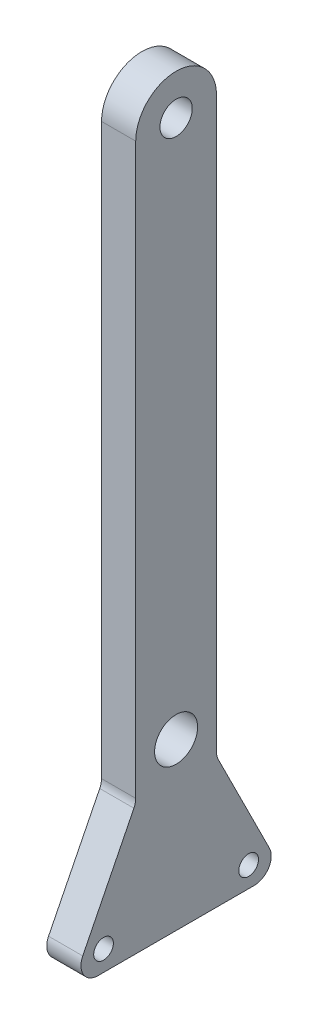
from build123d import *

# Parameters (mm, degrees)
SKETCH1_R           = 1.8288
SKETCH1_R_2         = 4
SKETCH1_R_3         = 3
BOSS_EXTRUDE1_DEPTH = 6.35
FILLET1_R           = 3.175


with BuildPart() as part:
    # Sketch1 → Boss-Extrude1 (new body)
    with BuildSketch(Plane(origin=(0, 0, 0), x_dir=(0, 0, -1), z_dir=(1, 0, 0))):
        with BuildLine():
            Line((-19.639409497, -3.81), (19.639409497, -3.81))
            Line((19.639409497, -3.81), (7.5, 20.468818994))
            Line((7.5, 20.468818994), (7.5, 126.9494))
            ThreePointArc((7.5, 126.9494), (0, 134.4494), (-7.5, 126.9494))
            Line((-7.5, 126.9494), (-7.5, 20.468818994))
            Line((-7.5, 20.468818994), (-19.639409497, -3.81))
        make_face()
        with Locations((-13.4747, 0)):
            Circle(SKETCH1_R, mode=Mode.SUBTRACT)
        with Locations((13.4747, 0)):
            Circle(SKETCH1_R, mode=Mode.SUBTRACT)
        with Locations((0, 26.9494)):
            Circle(SKETCH1_R_2, mode=Mode.SUBTRACT)
        with Locations((0, 126.9494)):
            Circle(SKETCH1_R_3, mode=Mode.SUBTRACT)
    extrude(amount=BOSS_EXTRUDE1_DEPTH)

    # Fillet1
    fillet1_edges = [part.edges().sort_by_distance(p)[0] for p in [
        (3.175, -3.81, -19.639409497),
        (3.175, -3.81, 19.639409497),
        (3.175, 20.468818994, -7.5),
        (3.175, 20.468818994, 7.5),
    ]]
    fillet(fillet1_edges, radius=FILLET1_R)


solid = part.part
